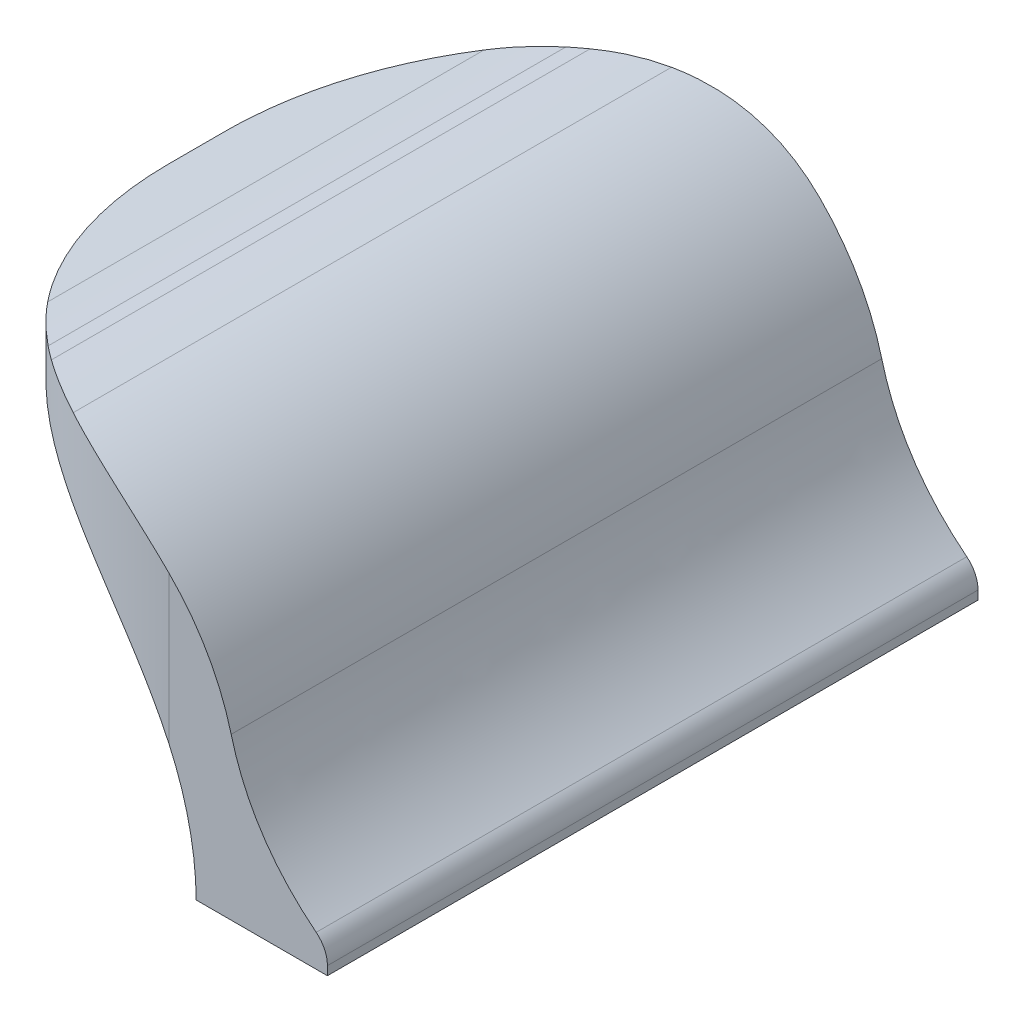
from build123d import *

# Parameters (mm, degrees)
SKETCH1_W           = 101.6
SKETCH1_H           = 219.075
BOSS_EXTRUDE2_DEPTH = 114.3
SKETCH2_R           = 101.6
CUT_EXTRUDE1_DEPTH  = 219.075
FILLET1_R           = 90
SKETCH3_W           = 35.162695898
SKETCH3_H           = 71.534417327
BOSS_EXTRUDE3_DEPTH = 219.075
CUT_EXTRUDE2_DEPTH  = 219.3
FILLET2_R           = 80
FILLET3_R           = 10
BOSS_EXTRUDE5_DEPTH = 219.075
FILLET5_R           = 100
FILLET7_R           = 100
FILLET11_R          = 100
FILLET12_R          = 100


with BuildPart() as part:
    # Sketch1 → Boss-Extrude2 (new body)
    with BuildSketch(Plane(origin=(0, 0, 0), x_dir=(1, 0, 0), z_dir=(0, 1, 0))):
        Rectangle(SKETCH1_W, SKETCH1_H)
    extrude(amount=BOSS_EXTRUDE2_DEPTH)

    # Sketch2 → Cut-Extrude1 (cut)
    with BuildSketch(Plane.XY.offset(109.5375)):
        with Locations((-73.196036425, 0)):
            Circle(SKETCH2_R)
    extrude(amount=-CUT_EXTRUDE1_DEPTH, mode=Mode.SUBTRACT)

    # Fillet1
    fillet1_edges = [part.edges().sort_by_distance(p)[0] for p in [
        (50.8, 114.3, 0),
    ]]
    fillet(fillet1_edges, radius=FILLET1_R)

    # Sketch3 → Boss-Extrude3 (add)
    with BuildSketch(Plane.XY.offset(109.5375)):
        with Locations((54.990158277, 35.767208663)):
            Rectangle(SKETCH3_W, SKETCH3_H)
    extrude(amount=-BOSS_EXTRUDE3_DEPTH)

    # Sketch4 → Cut-Extrude2 (cut)
    with BuildSketch(Plane.XY.offset(109.5375)):
        with BuildLine():
            Line((37.408810328, 71.534417327), (72.571506226, 71.534417327))
            Line((72.571506226, 71.534417327), (72.571506226, 7.917200167))
            add(Edge.make_bspline(
                [(37.408810328, 71.534417327), (40.159862315, 31.272718553), (72.571506226, 7.917200167)],
                knots=[0, 0, 0, 1, 1, 1], degree=2))
        make_face()
    extrude(amount=-CUT_EXTRUDE2_DEPTH, mode=Mode.SUBTRACT)

    # Fillet2
    fillet2_edges = [part.edges().sort_by_distance(p)[0] for p in [
        (37.408810328, 71.534417327, 0),
    ]]
    fillet(fillet2_edges, radius=FILLET2_R)

    # Fillet3
    fillet3_edges = [part.edges().sort_by_distance(p)[0] for p in [
        (72.571506226, 7.917200167, 0),
    ]]
    fillet(fillet3_edges, radius=FILLET3_R)

    # Sketch5 → Boss-Extrude5 (add)
    with BuildSketch(Plane.XY.offset(109.5375)):
        Polygon((-80.8, 99.100845367), (-80.8, 110.100845367), (-50.8, 114.3), (-50.8, 99.100845367), align=None)
    extrude(amount=-BOSS_EXTRUDE5_DEPTH)

    # Fillet5
    # the kernel refuses this fillet: 100 mm, written as the material it adds along each edge
    with BuildSketch(Plane(origin=(-50.8, 99.100845367, -109.5375), x_dir=(0.6243262651126902, -0.7811636926345457, 0), z_dir=(0, 0, 1))) as fillet5_piece_1:
        with BuildLine():
            CenterArc((65.135381338, -78.674577281), FILLET5_R, 51.882430425, 89.484815402)
            Line((-12.980987926, -16.24195077), (-14.543315311, -14.99329824))
            Line((-14.543315311, -14.99329824), (-1.562327385, 1.24865253))
            Line((-1.562327385, 1.24865253), (-1.24865253, 1.562327385))
            ThreePointArc((-1.24865253, 1.562327385), (63.431548535, 24.233768828), (128.097651386, 1.573491546))
            Line((128.097651386, 1.573491546), (126.863097071, 0))
        make_face()
    extrude(amount=219.075)

    # Fillet7
    fillet7_edges = [part.edges().sort_by_distance(p)[0] for p in [
        (-50.8, 114.3, 0),
    ]]
    fillet(fillet7_edges, radius=FILLET7_R)

    # Fillet11
    # the kernel refuses this fillet: 100 mm, written as the material it takes off along each edge
    with BuildSketch(Plane(origin=(-80.8, -150.899154633, -109.5375), x_dir=(1, 0, 0), z_dir=(0, 1, 0))) as fillet11_piece_1:
        with BuildLine():
            CenterArc((FILLET11_R, -FILLET11_R), FILLET11_R, 90, 90)
            Line((0, -FILLET11_R), (0, 0))
            Line((0, 0), (FILLET11_R, 0))
        make_face()
    extrude(amount=511, mode=Mode.SUBTRACT)

    # Fillet12
    # the kernel refuses this fillet: 100 mm, written as the material it takes off along each edge
    with BuildSketch(Plane(origin=(-80.8, -150.899154633, 109.5375), x_dir=(1, 0, 0), z_dir=(0, 1, 0))) as fillet12_piece_1:
        with BuildLine():
            CenterArc((FILLET12_R, FILLET12_R), FILLET12_R, 180, 90)
            Line((0, FILLET12_R), (0, 0))
            Line((0, 0), (FILLET12_R, 0))
        make_face()
    extrude(amount=511, mode=Mode.SUBTRACT)


solid = part.part
